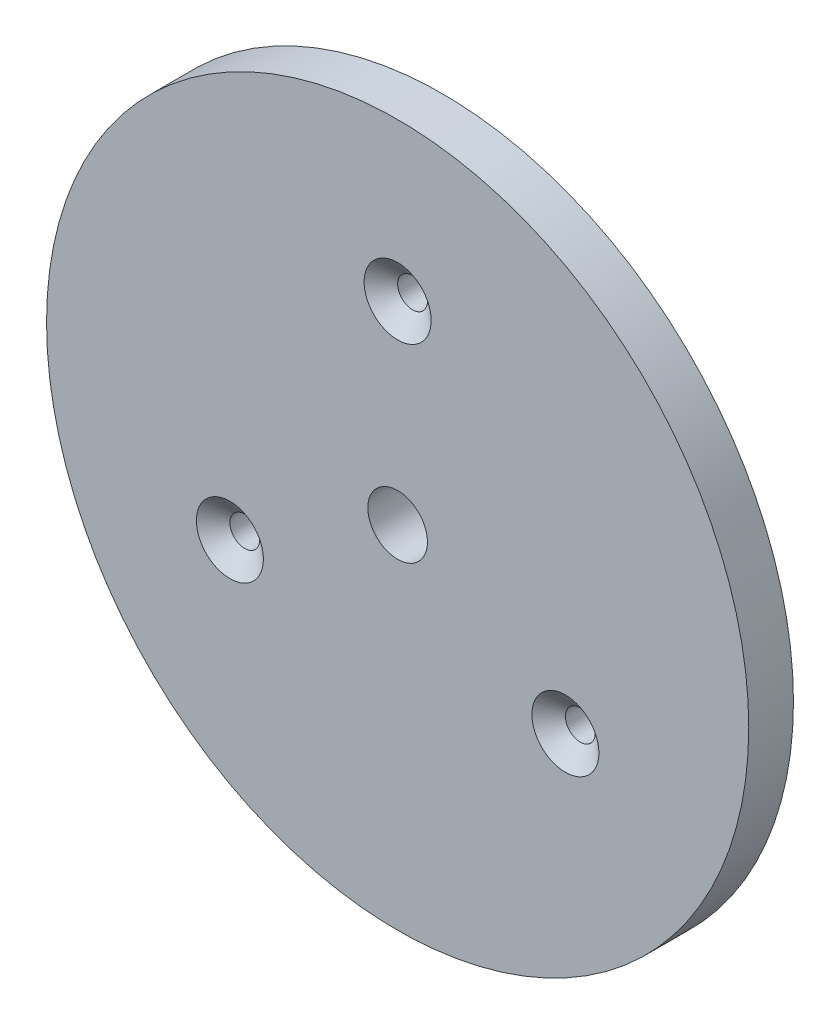
from build123d import *

# Parameters (mm, degrees)
SKETCH3_R           = 47.125
SKETCH3_R_2         = 4
SKETCH3_R_3         = 2
BOSS_EXTRUDE1_DEPTH = 6
CHAMFER1_SIZE       = 2.5
CHAMFER1_SIZE2      = 2


with BuildPart() as part:
    # Sketch3 → Boss-Extrude1 (new body)
    with BuildSketch(Plane(origin=(0, 0, 0), x_dir=(0, 1, 0), z_dir=(0, 0, 1))):
        Circle(SKETCH3_R)
        Circle(SKETCH3_R_2, mode=Mode.SUBTRACT)
        with Locations((26, 0)):
            Circle(SKETCH3_R_3, mode=Mode.SUBTRACT)
        with Locations((-13, -22.516660498)):
            Circle(SKETCH3_R_3, mode=Mode.SUBTRACT)
        with Locations((-13, 22.516660498)):
            Circle(SKETCH3_R_3, mode=Mode.SUBTRACT)
    extrude(amount=BOSS_EXTRUDE1_DEPTH)

    # Chamfer1
    chamfer1_edges = [part.edges().sort_by_distance(p)[0] for p in [
        (-22.516660498, -15, 6),
        (22.516660498, -15, 6),
        (0, 24, 6),
    ]]
    chamfer1_side = [part.faces().sort_by_distance(p)[0] for p in [
        (0, -45.792103717, 6),
    ]]
    chamfer(chamfer1_edges, length=CHAMFER1_SIZE, length2=CHAMFER1_SIZE2, reference=chamfer1_side[0])


solid = part.part
